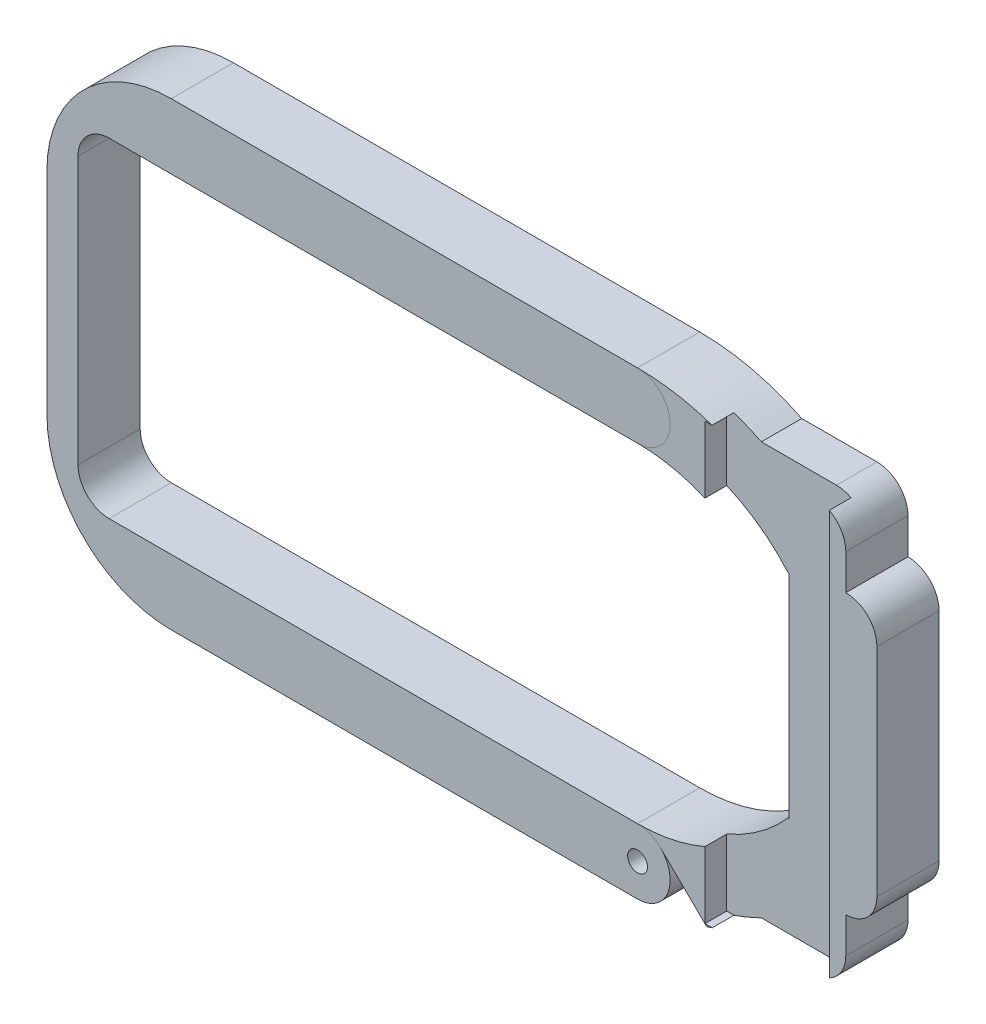
from build123d import *

# Parameters (mm, degrees)
BOSS_EXTRUDE1_DEPTH = 10
BOSS_EXTRUDE2_DEPTH = 10
SKETCH2_W           = 20
SKETCH2_H           = 70
CUT_EXTRUDE1_DEPTH  = 3.5
SKETCH3_R           = 1.6
CUT_EXTRUDE2_DEPTH  = 253.373599124


# Read off the part's stored shape, not the designer's step: Boss-Extrude2
with BuildPart() as part:
    # Sketch1 → Boss-Extrude1 (new body)
    with BuildSketch(Plane.XY):
        with BuildLine():
            Line((-143.092977135, -153.645932851), (-143.092977135, -187.645932851))
            ThreePointArc((-143.092977135, -187.645932851), (-137.235112759, -201.788068475), (-123.092977135, -207.645932851))
            Line((-123.092977135, -207.645932851), (-48.092977135, -207.645932851))
            ThreePointArc((-48.092977135, -207.645932851), (-42.842977135, -202.395932851), (-48.092977135, -197.145932851))
            Line((-48.092977135, -197.145932851), (-133.092977135, -197.145932851))
            ThreePointArc((-133.092977135, -197.145932851), (-136.628511041, -195.681466757), (-138.092977135, -192.145932851))
            Line((-138.092977135, -192.145932851), (-138.092977135, -149.145932851))
            ThreePointArc((-138.092977135, -149.145932851), (-136.628511041, -145.610398945), (-133.092977135, -144.145932851))
            Line((-133.092977135, -144.145932851), (-48.092977135, -144.145932851))
            ThreePointArc((-48.092977135, -144.145932851), (-42.842977135, -138.895932851), (-48.092977135, -133.645932851))
            Line((-48.092977135, -133.645932851), (-123.092977135, -133.645932851))
            ThreePointArc((-123.092977135, -133.645932851), (-137.235112759, -139.503797227), (-143.092977135, -153.645932851))
        make_face()
    extrude(amount=BOSS_EXTRUDE1_DEPTH)

    # Sketch3 → Cut-Extrude2 (cut, through all)
    with BuildSketch(Plane.XY.offset(10)):
        with Locations((-48.092977135, -202.395935058)):
            Circle(SKETCH3_R)
    extrude(amount=-CUT_EXTRUDE2_DEPTH, mode=Mode.SUBTRACT)


with BuildPart() as body_2:
    # Boss-Extrude2 outline → Boss-Extrude2 (new body)
    with BuildSketch(Plane.XY):
        with BuildLine():
            ThreePointArc((-19.594596165, -203.80263398), (-16.059062259, -202.338167886), (-14.594596165, -198.80263398))
            Line((-14.594596165, -198.80263398), (-14.594596165, -193.072403439))
            Line((-14.594596165, -193.072403439), (-14.592977135, -193.072403439))
            ThreePointArc((-14.592977135, -193.072403439), (-11.057443229, -191.607937345), (-9.592977135, -188.072403439))
            Line((-9.592977135, -188.072403439), (-9.592977135, -153.219462263))
            ThreePointArc((-9.592977135, -153.219462263), (-11.05744323, -149.683928358), (-14.592977135, -148.219462263))
            Line((-14.592977135, -148.219462263), (-14.592977135, -142.488886754))
            ThreePointArc((-14.592977135, -142.488886754), (-16.05744323, -138.953352849), (-19.592977135, -137.488886754))
            Line((-19.592977135, -137.488886754), (-31.673163065, -137.488886754))
            ThreePointArc((-31.673163065, -137.488886754), (-39.661212954, -134.619479337), (-48.092977135, -133.645932851))
            ThreePointArc((-48.092977135, -133.645932851), (-42.842977135, -138.895932851), (-48.092977135, -144.145932851))
            ThreePointArc((-48.092977135, -144.145932851), (-36.714532919, -146.610338046), (-27.375441215, -153.561859599))
            Line((-27.375441215, -153.561859599), (-27.250412325, -153.553105763))
            Line((-27.250412325, -153.553105763), (-27.250412325, -187.730006103))
            Line((-27.250412325, -187.730006103), (-27.375441215, -187.730006103))
            ThreePointArc((-27.375441215, -187.730006103), (-36.714532919, -194.681527655), (-48.092977135, -197.145932851))
            ThreePointArc((-48.092977135, -197.145932851), (-46.083888931, -197.545565381), (-44.380666253, -198.683622531))
            Line((-44.380666253, -198.683622531), (-36.959303905, -205.931076013))
            ThreePointArc((-36.959303905, -205.931076013), (-34.274842822, -204.968799513), (-31.672465962, -203.80263398))
            Line((-31.672465962, -203.80263398), (-19.594596165, -203.80263398))
        make_face()
    extrude(amount=BOSS_EXTRUDE2_DEPTH)

    # Sketch2 → Cut-Extrude1 (cut)
    with BuildSketch(Plane.XY.offset(10)):
        with Locations((-27.250412325, -170.641555933)):
            Rectangle(SKETCH2_W, SKETCH2_H)
    extrude(amount=-CUT_EXTRUDE1_DEPTH, mode=Mode.SUBTRACT)


solid = Compound([part.part, body_2.part])
